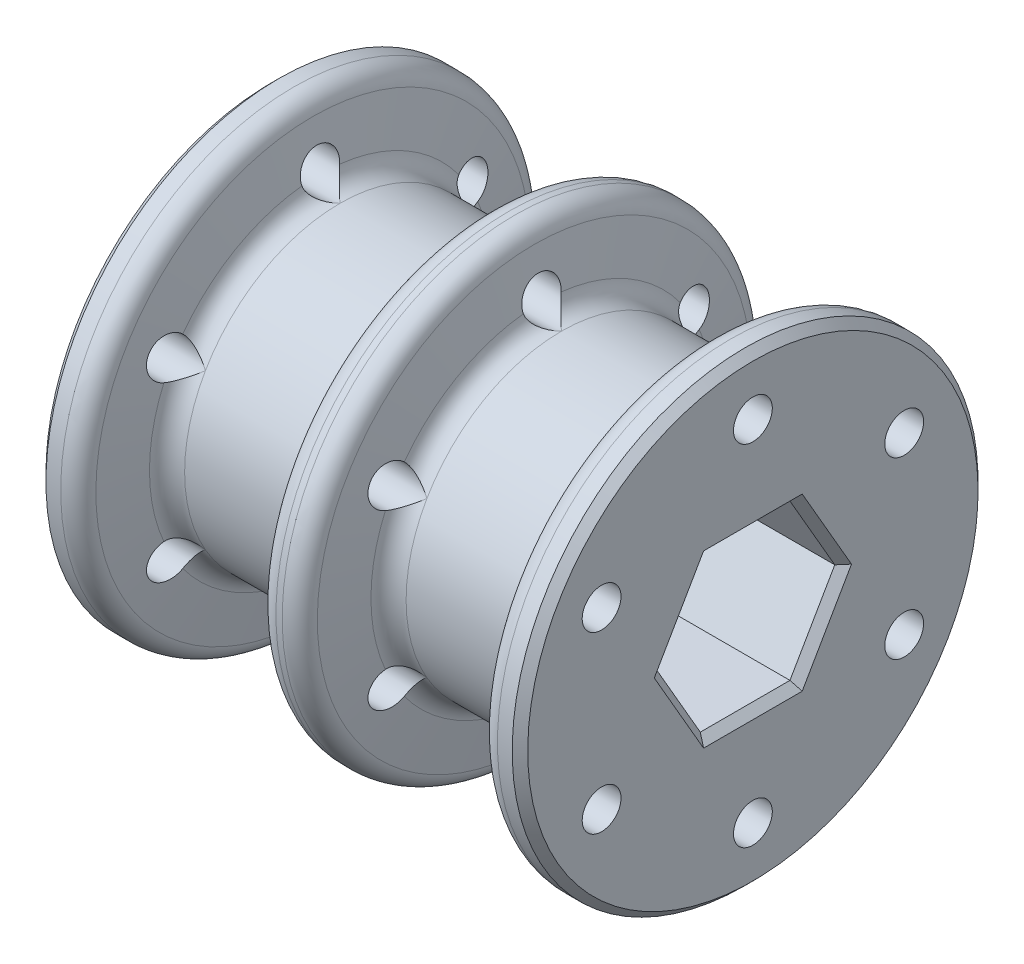
from build123d import *

# Parameters (mm, degrees)
FILLET1_R                    = 1.5875
CHAMFER1_SIZE                = 0.635
CUT_EXTRUDE1_DEPTH           = 48.733185519
FILLET2_R                    = 1.5875
F_1_8_0_125_DIAMETER_HOLE1_D = 3.175
CHAMFER2_SIZE                = 0.635


with BuildPart() as part:
    # Sketch1 → Revolve1 (revolve)
    with BuildSketch(Plane.XY):
        Polygon((0, 0), (0, 19.05), (3.175, 19.05), (4.294676327, 12.7), (16.994676327, 12.7), (18.114352655, 19.05), (21.289352655, 19.05), (22.409028982, 12.7), (35.109028982, 12.7), (36.22870531, 19.05), (39.40370531, 19.05), (39.40370531, 0), align=None)
    revolve(axis=Axis((39.40370531, 0, 0), (-1, 0, 0)))

    # Fillet1
    fillet1_edges = [part.edges().sort_by_distance(p)[0] for p in [
        (36.22870531, -19.05, 0),
        (3.175, -19.05, 0),
        (18.114352655, -19.05, 0),
        (21.289352655, -19.05, 0),
    ]]
    fillet(fillet1_edges, radius=FILLET1_R)

    # Chamfer1
    chamfer1_edges = [part.edges().sort_by_distance(p)[0] for p in [
        (0, -19.05, 0),
        (39.40370531, -19.05, 0),
    ]]
    chamfer(chamfer1_edges, length=CHAMFER1_SIZE)

    # Sketch2 → Cut-Extrude1 (cut, through all)
    with BuildSketch(Plane.ZY):
        Polygon((7.332348419, 0), (3.666174209, 6.35), (-3.666174209, 6.35), (-7.332348419, 0), (-3.666174209, -6.35), (3.666174209, -6.35), align=None)
    extrude(amount=-CUT_EXTRUDE1_DEPTH, mode=Mode.SUBTRACT)

    # Fillet2
    fillet2_edges = [part.edges().sort_by_distance(p)[0] for p in [
        (35.109028982, -12.7, 0),
        (22.409028982, -12.7, 0),
        (16.994676327, -12.7, 0),
        (4.294676327, -12.7, 0),
    ]]
    fillet(fillet2_edges, radius=FILLET2_R)

    # 1/8 (0.125) Diameter Hole1 (through all)
    with Locations(Plane.ZY):
        with Locations((0, 14.2875), (12.373337957, 7.14375), (12.373337957, -7.14375), (0, -14.2875), (-12.373337957, -7.14375), (-12.373337957, 7.14375)):
            Hole(F_1_8_0_125_DIAMETER_HOLE1_D / 2)

    # Chamfer2
    chamfer2_edges = [part.edges().sort_by_distance(p)[0] for p in [
        (39.40370531, 6.35, 0),
        (39.40370531, 3.175, 5.499261314),
        (39.40370531, -3.175, 5.499261314),
        (39.40370531, -6.35, 0),
        (39.40370531, -3.175, -5.499261314),
        (39.40370531, 3.175, -5.499261314),
        (0, -3.175, -5.499261314),
        (0, -6.35, 0),
        (0, -3.175, 5.499261314),
        (0, 3.175, 5.499261314),
        (0, 6.35, 0),
        (0, 3.175, -5.499261314),
    ]]
    chamfer(chamfer2_edges, length=CHAMFER2_SIZE)


solid = part.part
